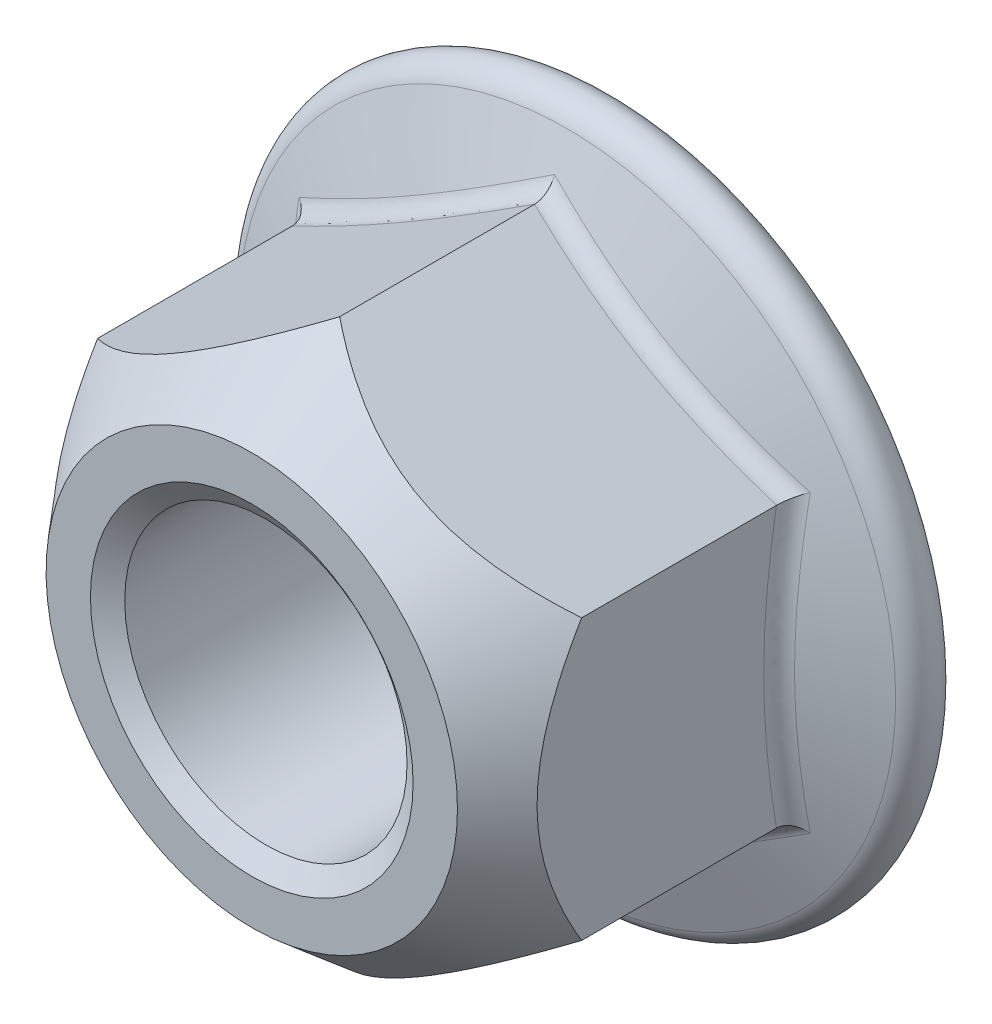
from build123d import *

# Parameters (mm, degrees)
BASENUT_START  = -22.5298
BASENUTSKE_R   = 8.75
BASENUT_DEPTH  = 22.5298
FLANGEFILLET_R = 1.2


# Read off the part's stored shape, not the designer's step: ThreadSchematic
with BuildPart() as part:
    # BaseNutSke → BaseNut (new body)
    with BuildSketch(Plane.XY.offset(BASENUT_START)):
        Polygon((15, 8.660254038), (15, -8.660254038), (0, -17.320508076), (-15, -8.660254038), (-15, 8.660254038), (0, 17.320508076), align=None)
        Circle(BASENUTSKE_R, mode=Mode.SUBTRACT)
    extrude(amount=BASENUT_DEPTH)

    # Sketch5 (on Right Plane) → EndChamfer (revolve, cut)
    with BuildSketch(Plane(origin=(0, 0, 0), x_dir=(0, 0, -1), z_dir=(1, 0, 0)), mode=Mode.PRIVATE) as endchamfer_sk:
        Polygon((22.5044, 10), (21.541614635, 8.625), (22.5552, 8.625), (22.5552, 10), align=None)
    revolve(endchamfer_sk.sketch.rotate(Axis((0, 0, -25.037505729), (0, 0, -1)), 90), axis=Axis((0, 0, -25.037505729), (0, 0, -1)), mode=Mode.SUBTRACT)

    # Sketch6 → Flange (revolve)
    with BuildSketch(Plane(origin=(0, 0, 0), x_dir=(0, 0, -1), z_dir=(1, 0, 0)), mode=Mode.PRIVATE) as flange_sk:
        with BuildLine():
            Line((15.29597298, 8.75), (19.5298, 20.382344136))
            ThreePointArc((19.5298, 20.382344136), (21.251733857, 21.376503112), (22.5298, 19.853363194))
            Line((22.5298, 19.853363194), (22.5298, 8.75))
            Line((22.5298, 8.75), (15.29597298, 8.75))
        make_face()
    revolve(flange_sk.sketch.rotate(Axis((0, 0, 0), (0, 0, -1)), 90), axis=Axis((0, 0, 0), (0, 0, -1)))

    # Sketch3 → Double-Chamfer (revolve, cut)
    with BuildSketch(Plane(origin=(0, 0, 0), x_dir=(0, 0, -1), z_dir=(1, 0, 0)), mode=Mode.PRIVATE) as double_chamfer_sk:
        Polygon((5.446919419, 30.020508076), (-12.7, 30.020508076), (-12.7, 12.75), (0, 12.75), (5.446919419, 17.320508076), align=None)
    revolve(double_chamfer_sk.sketch.rotate(Axis((0, 0, 0), (0, 0, -1)), 239.999999998), axis=Axis((0, 0, 0), (0, 0, -1)), mode=Mode.SUBTRACT)

    # FlangeFillet
    flangefillet_edges = [part.edges().sort_by_distance(p)[0] for p in [
        (15, 4.349016441, -17.795627563),
        (7.5, 12.990381057, -17.570786944),
        (-7.5, 12.990381057, -17.570786944),
        (-15, 0, -17.570786944),
        (-7.5, -12.990381057, -17.570786944),
        (7.5, -12.990381057, -17.570786944),
        (15, -4.349016441, -17.795627563),
    ]]
    fillet(flangefillet_edges, radius=FLANGEFILLET_R)

    # ThreadSchematic outline → ThreadSchematic (revolve, cut)
    with BuildSketch(Plane.XZ):
        Polygon((8.75, 0), (8.75, -0.875259423), (10, 0), align=None)
        Polygon((10, -22.5044), (8.75, -21.629140577), (8.75, -22.5298), (10, -22.5298), align=None)
    revolve(axis=Axis((0, 0, 0), (0, 0, 1)), mode=Mode.SUBTRACT)


solid = part.part
